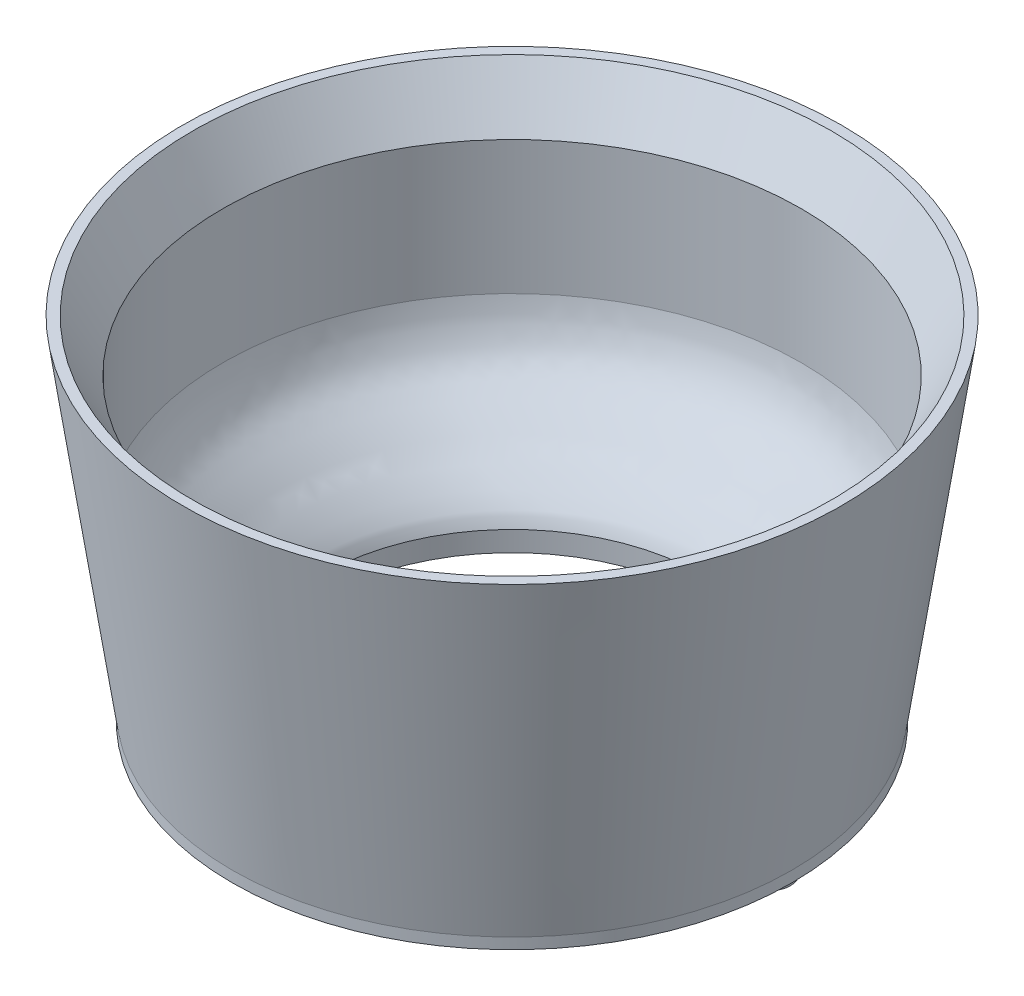
from build123d import *

# Parameters (mm, degrees)
SKETCH4_R           = 3
BOSS_EXTRUDE1_DEPTH = 2
SKETCH9_R           = 1.5
CUT_EXTRUDE1_DEPTH  = 6
SKETCH10_R          = 2
CUT_EXTRUDE2_DEPTH  = 0.5
CHAMFER3_SIZE       = 0.55
SKETCH11_R          = 26.8
CUT_EXTRUDE3_DEPTH  = 83.07769274


with BuildPart() as part:
    # Sketch2 → Revolve6 (revolve)
    with BuildSketch(Plane(origin=(0, 0, 0), x_dir=(0, 0, -1), z_dir=(1, 0, 0))):
        with BuildLine():
            Line((26.5077562, 274.996982717), (26.5077562, 273.848618937))
            Line((26.5077562, 273.848618937), (39.220771912, 273.848618937))
            Line((39.220771912, 273.848618937), (46.181267187, 321.561079724))
            Line((46.181267187, 321.561079724), (44.775299462, 321.561079724))
            Line((44.775299462, 321.561079724), (40.547674755, 314.238618937))
            Line((40.547674755, 314.238618937), (40.547674755, 295.540718438))
            add(Edge.make_bspline(
                [(40.547674755, 295.540718438), (40.447740466, 295.012709616), (40.292777353, 293.970757619), (39.930889755, 292.587532753), (39.516186416, 291.581451359), (39.108370782, 290.57804728), (38.439698054, 289.316986818), (37.331416086, 288.032583079), (36.368363881, 287.115418474), (35.630231264, 286.340079673), (35.016472726, 285.762737126), (34.394259795, 285.247169223), (33.635524662, 284.556557999), (32.920361334, 283.771384038), (32.129651901, 282.986073936), (31.485241784, 282.459482323), (30.914997208, 281.963476573), (30.371700346, 281.391298159), (29.782796159, 280.80462685), (29.227584581, 280.262154528), (28.724752618, 279.674853681), (28.180386253, 279.039651715), (27.651838315, 278.470209992), (27.308145935, 277.876839187), (26.995230081, 277.127164256), (26.597952618, 276.164510632), (26.464811583, 275.470548141), (26.5077562, 274.996982717)],
                knots=[0, 0, 0, 0, 0.062544048, 0.125088096, 0.156360121, 0.187632145, 0.250176193, 0.312720241, 0.375264289, 0.406536313, 0.437808337, 0.469080362, 0.500352386, 0.562896434, 0.594168458, 0.625440482, 0.656712506, 0.68798453, 0.719256554, 0.750528579, 0.781800603, 0.813072627, 0.844344651, 0.875616675, 0.906888699, 0.938160723, 1.000704771, 1.000704771, 1.000704771, 1.000704771], degree=3))
        make_face()
    revolve(axis=Axis((0, 5, 0), (0, 1, 0)))

    # Sketch4 → Boss-Extrude1 (add)
    with BuildSketch(Plane.XZ.offset(-273.848618937)):
        with Locations(Location((-31.176914536, 18, 0), (0, 0, 270))):
            Circle(SKETCH4_R)
        with Locations(Location((36, 0, 0), (0, 0, 270))):
            Circle(SKETCH4_R)
    extrude(amount=BOSS_EXTRUDE1_DEPTH)

    # Sketch7 → Revolve7 (revolve)
    with BuildSketch(Plane(origin=(0, 0, 0), x_dir=(0, 0, -1), z_dir=(1, 0, 0))):
        with BuildLine():
            Line((39.220771912, 273.848618937), (39.220771912, 272.319355593))
            ThreePointArc((39.220771912, 272.319355593), (32.873157949, 273.157923648), (26.5077562, 273.848618937))
            Line((26.5077562, 273.848618937), (26.5077562, 274.348618937))
            Line((26.5077562, 274.348618937), (39.220771912, 274.348618937))
            Line((39.220771912, 274.348618937), (39.220771912, 273.848618937))
        make_face()
    revolve(axis=Axis((0, 5, 0), (0, 1, 0)))

    # Sketch9 → Cut-Extrude1 (cut)
    with BuildSketch(Plane.XZ.offset(-271.848618937)):
        with Locations(Location((36, 0, 0), (0, 0, 270))):
            Circle(SKETCH9_R)
        with Locations(Location((-31.176914536, 18, 0), (0, 0, 270))):
            Circle(SKETCH9_R)
    extrude(amount=-CUT_EXTRUDE1_DEPTH, mode=Mode.SUBTRACT)

    # Sketch10 → Cut-Extrude2 (cut)
    with BuildSketch(Plane.XZ.offset(-271.848618937)):
        with Locations(Location((36, 0, 0), (0, 0, 270))):
            Circle(SKETCH10_R)
        with Locations(Location((-31.176914536, 18, 0), (0, 0, 270))):
            Circle(SKETCH10_R)
    extrude(amount=-CUT_EXTRUDE2_DEPTH, mode=Mode.SUBTRACT)

    # Chamfer3
    # the kernel refuses this chamfer: 0.55 mm, written as the material it takes off along each edge
    with BuildSketch(Plane(origin=(36, 271.848618937, 0), x_dir=(0, 0, -1), z_dir=(-1, 0, 0))) as chamfer3_piece_1_section:
        Polygon((2 + CHAMFER3_SIZE, 0), (2, -CHAMFER3_SIZE), (2, 0), align=None)
    chamfer3_piece_1 = revolve(axis=Axis((36, 271.848618937, 0), (0, -1, 0)), mode=Mode.PRIVATE)
    chamfer3_piece_1 = split(chamfer3_piece_1, bisect_by=Plane(origin=(36, 272.348618937, 2.298516155), z_dir=(0, -1, 0)), keep=Keep.TOP, mode=Mode.PRIVATE)
    add(chamfer3_piece_1, mode=Mode.SUBTRACT)
    with BuildSketch(Plane(origin=(-31.176914536, 271.848618937, 18), x_dir=(0, 0, -1), z_dir=(-1, 0, 0))) as chamfer3_piece_2_section:
        Polygon((2 + CHAMFER3_SIZE, 0), (2, -CHAMFER3_SIZE), (2, 0), align=None)
    chamfer3_piece_2 = revolve(axis=Axis((-31.176914536, 271.848618937, 18), (0, -1, 0)), mode=Mode.PRIVATE)
    chamfer3_piece_2 = split(chamfer3_piece_2, bisect_by=Plane(origin=(-31.176914536, 272.348618937, 20.298516155), z_dir=(0, -1, 0)), keep=Keep.TOP, mode=Mode.PRIVATE)
    add(chamfer3_piece_2, mode=Mode.SUBTRACT)

    # Sketch11 → Cut-Extrude3 (cut, through all)
    with BuildSketch(Plane(origin=(0, 321.561079724, 0), x_dir=(1, 0, 0), z_dir=(0, 1, 0))):
        with Locations(Location((0, 0, 0), (0, 0, 90))):
            Circle(SKETCH11_R)
    extrude(amount=-CUT_EXTRUDE3_DEPTH, mode=Mode.SUBTRACT)


solid = part.part
